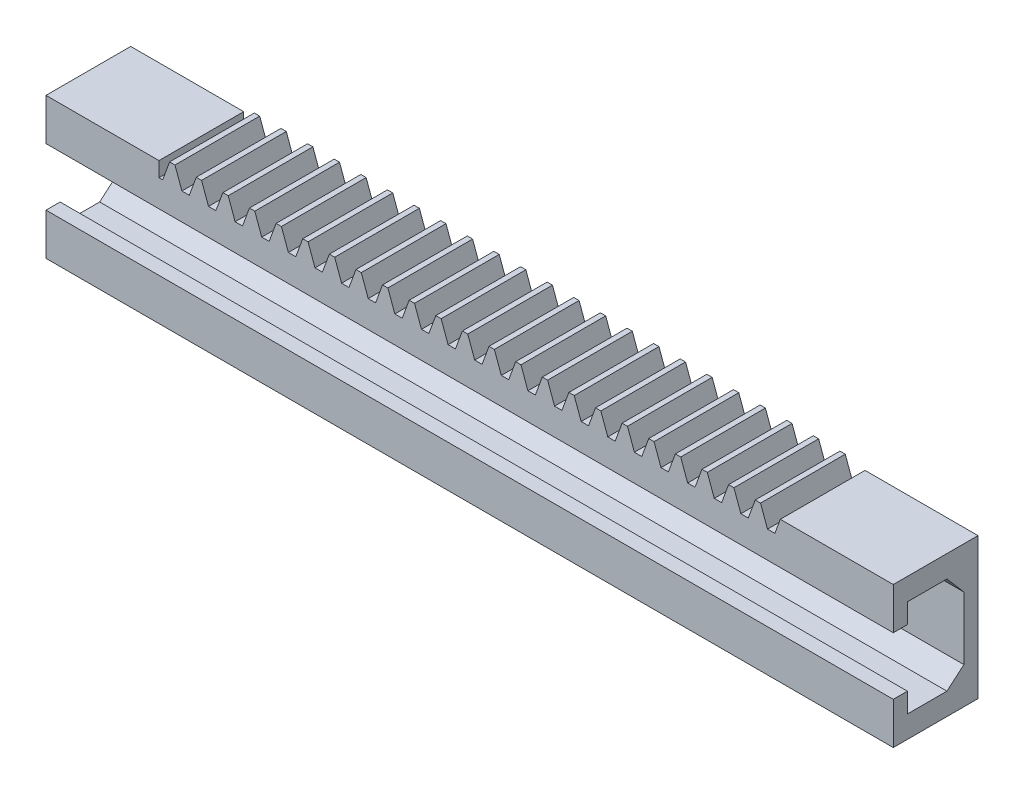
from build123d import *

# Parameters (mm, degrees)
BLANKSKE_W              = 110
BLANKSKE_H              = 11.5
BLANK_DEPTH             = 15
TOOTHCUTSIM_DEPTH       = 112.612051321
TEETHCUTS_COUNT         = 25
TEETHCUTS_PITCH         = 4.712388975
SKETCH1_W               = 15
SKETCH1_H               = 10.763678744
BOSS_EXTRUDE1_DEPTH     = 20
SKETCH4_W               = 15
SKETCH4_H               = 10.764
BOSS_EXTRUDE2_DEPTH     = 20
SKETCH5_W               = 150
SKETCH5_H               = 15
BOSS_EXTRUDE3_DEPTH     = 14.236
CUT_EXTRUDE1_DEPTH      = 152.418835341
CUT_EXTRUDE1_DEPTH_BACK = 152.418835341


with BuildPart() as part:
    # BlankSke → Blank (new body)
    with BuildSketch(Plane.XY):
        with Locations((55, 5.75)):
            Rectangle(BLANKSKE_W, BLANKSKE_H)
    extrude(amount=-BLANK_DEPTH)

    # TooCutSkeSim → ToothCutSim (cut, through all)
    with BuildSketch(Plane.XY):
        Polygon((0.654653055, 8.125), (-0.654653055, 8.125), (-1.892297439, 11.5254), (1.892297439, 11.5254), align=None)
    toothcutsim = extrude(amount=-TOOTHCUTSIM_DEPTH, mode=Mode.SUBTRACT)

    # TeethCuts: ToothCutSim ×25
    with Locations(*[(i * TEETHCUTS_PITCH, 0, 0) for i in range(1, TEETHCUTS_COUNT)]):
        add(toothcutsim, mode=Mode.SUBTRACT)

    # Sketch1 → Boss-Extrude1 (add)
    with BuildSketch(Plane(origin=(110, 0, 0), x_dir=(0, 0, -1), z_dir=(1, 0, 0))):
        with Locations((7.5, 5.381839372)):
            Rectangle(SKETCH1_W, SKETCH1_H)
    extrude(amount=BOSS_EXTRUDE1_DEPTH)

    # Sketch4 → Boss-Extrude2 (add)
    with BuildSketch(Plane.ZY):
        with Locations((-7.5, 5.382)):
            Rectangle(SKETCH4_W, SKETCH4_H)
    extrude(amount=BOSS_EXTRUDE2_DEPTH)

    # Sketch5 → Boss-Extrude3 (add)
    with BuildSketch(Plane.XZ):
        with Locations((55, -7.5)):
            Rectangle(SKETCH5_W, SKETCH5_H)
    extrude(amount=BOSS_EXTRUDE3_DEPTH)

    # Sketch7 → Cut-Extrude1 (cut, two sides: drawn at the far end of the back side and taken through both)
    with BuildSketch(Plane.ZY.offset(20).offset(-CUT_EXTRUDE1_DEPTH_BACK)):
        Polygon((-2.5, -10.336), (-2.5, -6.836), (0, -6.836), (0, 3.364), (-2.5, 3.364), (-2.5, 6.864), (-9.5, 6.864), (-12.5, 3.364), (-12.5, -1.736), (-12.5, -7.764571429), (-9.5, -10.336), (-7.5, -10.336), align=None)
    extrude(amount=CUT_EXTRUDE1_DEPTH + CUT_EXTRUDE1_DEPTH_BACK, mode=Mode.SUBTRACT)


solid = part.part
